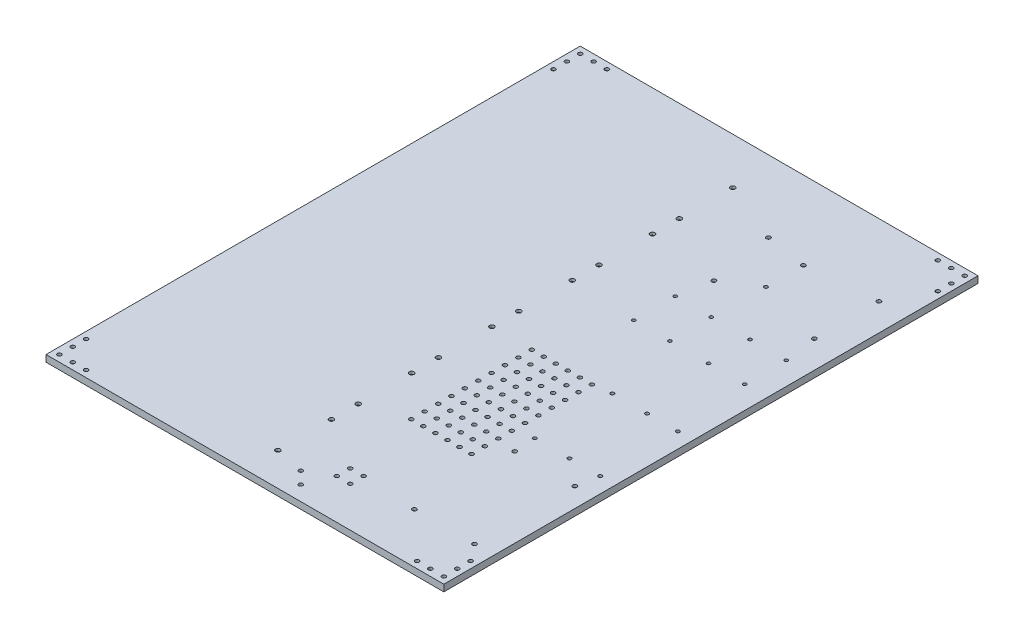
from build123d import *

# Parameters (mm, degrees)
SKETCH1_W           = 297.5
SKETCH1_H           = 399.5
BOSS_EXTRUDE1_DEPTH = 5
SKETCH3_R           = 1.749864578
SKETCH3_R_2         = 1.750391844
SKETCH3_R_3         = 1.750224182
SKETCH3_R_4         = 1.74961836
SKETCH3_R_5         = 1.75096205
SKETCH3_R_6         = 1.748620385
SKETCH3_R_7         = 1.748899818
SKETCH3_R_8         = 1.749915058
SKETCH3_R_9         = 1.748890378
SKETCH3_R_10        = 1.750988741
SKETCH3_R_11        = 1.752219163
CUT_EXTRUDE2_DEPTH  = 10
SKETCH5_R           = 1.5
CUT_EXTRUDE3_DEPTH  = 10
CUT_EXTRUDE4_START  = -3
SKETCH6_R           = 1.5
CUT_EXTRUDE4_DEPTH  = 3
CUT_EXTRUDE5_DEPTH  = 3
SKETCH13_R          = 1.5
CUT_EXTRUDE6_DEPTH  = 5
CUT_EXTRUDE7_DEPTH  = 3
SKETCH15_R          = 1.5
CUT_EXTRUDE8_DEPTH  = 10
CUT_EXTRUDE9_DEPTH  = 3
SKETCH21_R          = 1.5508
SKETCH21_R_2        = 1.5621
SKETCH21_R_3        = 1.315256363
CUT_EXTRUDE10_DEPTH = 10
SKETCH22_R          = 1.5
CUT_EXTRUDE11_DEPTH = 10
SKETCH23_R          = 4.5
CUT_EXTRUDE12_DEPTH = 3
CUT_EXTRUDE13_DEPTH = 5
CUT_EXTRUDE14_DEPTH = 3


with BuildPart() as part:
    # Sketch1 → Boss-Extrude1 (new body)
    with BuildSketch(Plane(origin=(0, 0, 0), x_dir=(1, 0, 0), z_dir=(0, 1, 0))):
        with Locations((148.75, 199.75)):
            Rectangle(SKETCH1_W, SKETCH1_H)
    extrude(amount=BOSS_EXTRUDE1_DEPTH)

    # Sketch3 → Cut-Extrude2 (cut)
    with BuildSketch(Plane(origin=(0, 5, 0), x_dir=(1, 0, 0), z_dir=(0, 1, 0))):
        with Locations((148.748083814, 24.684748422)):
            Circle(SKETCH3_R)
        with Locations((148.748340036, 64.683726641)):
            Circle(SKETCH3_R_2)
        with Locations((148.75044634, 84.720729049)):
            Circle(SKETCH3_R_3)
        with Locations((148.748021994, 124.721020588)):
            Circle(SKETCH3_R_4)
        with Locations((148.749007517, 144.750094856)):
            Circle(SKETCH3_R_5)
        with Locations((148.747543438, 184.752595185)):
            Circle(SKETCH3_R_6)
        with Locations((148.747015223, 204.786810925)):
            Circle(SKETCH3_R_7)
        with Locations((148.748242067, 244.786829837)):
            Circle(SKETCH3_R_8)
        with Locations((148.746998642, 264.816839038)):
            Circle(SKETCH3_R_9)
        with Locations((148.750231988, 304.815858705)):
            Circle(SKETCH3_R_10)
        with Locations((148.747015223, 324.852824112)):
            Circle(SKETCH3_R_7)
        with Locations((148.751036789, 364.852854296)):
            Circle(SKETCH3_R_11)
    extrude(amount=-CUT_EXTRUDE2_DEPTH, mode=Mode.SUBTRACT)

    # Sketch5 → Cut-Extrude3 (cut)
    with BuildSketch(Plane(origin=(0, 5, 0), x_dir=(1, 0, 0), z_dir=(0, 1, 0))):
        with Locations((5, 5)):
            Circle(SKETCH5_R)
        with Locations((5, 15)):
            Circle(SKETCH5_R)
        with Locations((15, 5)):
            Circle(SKETCH5_R)
        with Locations((5, 25)):
            Circle(SKETCH5_R)
        with Locations((25, 5)):
            Circle(SKETCH5_R)
        with Locations((25, 394.5)):
            Circle(SKETCH5_R)
        with Locations((15, 394.5)):
            Circle(SKETCH5_R)
        with Locations((5, 374.5)):
            Circle(SKETCH5_R)
        with Locations((5, 384.5)):
            Circle(SKETCH5_R)
        with Locations((5, 394.5)):
            Circle(SKETCH5_R)
        with Locations((292.5, 374.5)):
            Circle(SKETCH5_R)
        with Locations((292.5, 384.5)):
            Circle(SKETCH5_R)
        with Locations((292.5, 394.5)):
            Circle(SKETCH5_R)
        with Locations((282.5, 394.5)):
            Circle(SKETCH5_R)
        with Locations((272.5, 394.5)):
            Circle(SKETCH5_R)
        with Locations((292.5, 25)):
            Circle(SKETCH5_R)
        with Locations((292.5, 15)):
            Circle(SKETCH5_R)
        with Locations((292.5, 5)):
            Circle(SKETCH5_R)
        with Locations((282.5, 5)):
            Circle(SKETCH5_R)
        with Locations((272.5, 5)):
            Circle(SKETCH5_R)
    extrude(amount=-CUT_EXTRUDE3_DEPTH, mode=Mode.SUBTRACT)

    # Sketch6 → Cut-Extrude4 (cut)
    # profile 1 of 20: a face of its own
    with BuildSketch(Plane.XZ.offset(CUT_EXTRUDE4_START)):
        Polygon((3.104551732, -391.216987298), (1.209103465, -394.5), (3.104551732, -397.783012702), (6.895448268, -397.783012702), (8.790896535, -394.5), (6.895448267, -391.216987298), align=None)
        with Locations((5, -394.5)):
            Circle(SKETCH6_R, mode=Mode.SUBTRACT)
    # profile 2 of 20: a face of its own
    with BuildSketch(Plane.XZ.offset(CUT_EXTRUDE4_START)):
        Polygon((3.104551732, -381.216987298), (1.209103465, -384.5), (3.104551732, -387.783012702), (6.895448267, -387.783012702), (8.790896535, -384.5), (6.895448267, -381.216987298), align=None)
        with Locations((5, -384.5)):
            Circle(SKETCH6_R, mode=Mode.SUBTRACT)
    # profile 3 of 20: a face of its own
    with BuildSketch(Plane.XZ.offset(CUT_EXTRUDE4_START)):
        Polygon((3.104551732, -371.216987298), (1.209103465, -374.5), (3.104551733, -377.783012702), (6.895448268, -377.783012702), (8.790896535, -374.5), (6.895448268, -371.216987298), align=None)
        with Locations((5, -374.5)):
            Circle(SKETCH6_R, mode=Mode.SUBTRACT)
    # profile 4 of 20: a face of its own
    with BuildSketch(Plane.XZ.offset(CUT_EXTRUDE4_START)):
        Polygon((13.104551732, -391.216987298), (11.209103465, -394.5), (13.104551732, -397.783012702), (16.895448267, -397.783012702), (18.790896535, -394.5), (16.895448267, -391.216987298), align=None)
        with Locations((15, -394.5)):
            Circle(SKETCH6_R, mode=Mode.SUBTRACT)
    # profile 5 of 20: a face of its own
    with BuildSketch(Plane.XZ.offset(CUT_EXTRUDE4_START)):
        Polygon((23.104551732, -391.216987298), (21.209103465, -394.5), (23.104551732, -397.783012702), (26.895448267, -397.783012702), (28.790896535, -394.5), (26.895448268, -391.216987298), align=None)
        with Locations((25, -394.5)):
            Circle(SKETCH6_R, mode=Mode.SUBTRACT)
    # profile 6 of 20: a face of its own
    with BuildSketch(Plane.XZ.offset(CUT_EXTRUDE4_START)):
        Polygon((1.209103465, -25), (3.104551732, -28.283012702), (6.895448268, -28.283012702), (8.790896535, -25), (6.895448268, -21.716987298), (3.104551733, -21.716987298), align=None)
        with Locations((5, -25)):
            Circle(SKETCH6_R, mode=Mode.SUBTRACT)
    # profile 7 of 20: a face of its own
    with BuildSketch(Plane.XZ.offset(CUT_EXTRUDE4_START)):
        Polygon((1.209103465, -15), (3.104551732, -18.283012702), (6.895448267, -18.283012702), (8.790896535, -15), (6.895448267, -11.716987298), (3.104551732, -11.716987298), align=None)
        with Locations((5, -15)):
            Circle(SKETCH6_R, mode=Mode.SUBTRACT)
    # profile 8 of 20: a face of its own
    with BuildSketch(Plane.XZ.offset(CUT_EXTRUDE4_START)):
        Polygon((1.209103465, -5), (3.104551732, -8.283012702), (6.895448267, -8.283012702), (8.790896535, -5), (6.895448268, -1.716987298), (3.104551732, -1.716987298), align=None)
        with Locations((5, -5)):
            Circle(SKETCH6_R, mode=Mode.SUBTRACT)
    # profile 9 of 20: a face of its own
    with BuildSketch(Plane.XZ.offset(CUT_EXTRUDE4_START)):
        Polygon((11.209103465, -5), (13.104551732, -8.283012702), (16.895448267, -8.283012702), (18.790896535, -5), (16.895448267, -1.716987298), (13.104551732, -1.716987298), align=None)
        with Locations((15, -5)):
            Circle(SKETCH6_R, mode=Mode.SUBTRACT)
    # profile 10 of 20: a face of its own
    with BuildSketch(Plane.XZ.offset(CUT_EXTRUDE4_START)):
        Polygon((21.209103465, -5), (23.104551732, -8.283012702), (26.895448268, -8.283012702), (28.790896535, -5), (26.895448267, -1.716987298), (23.104551732, -1.716987298), align=None)
        with Locations((25, -5)):
            Circle(SKETCH6_R, mode=Mode.SUBTRACT)
    # profile 11 of 20: a face of its own
    with BuildSketch(Plane.XZ.offset(CUT_EXTRUDE4_START)):
        Polygon((268.709103465, -5), (270.604551732, -8.283012702), (274.395448267, -8.283012702), (276.290896535, -5), (274.395448267, -1.716987298), (270.604551732, -1.716987298), align=None)
        with Locations((272.5, -5)):
            Circle(SKETCH6_R, mode=Mode.SUBTRACT)
    # profile 12 of 20: a face of its own
    with BuildSketch(Plane.XZ.offset(CUT_EXTRUDE4_START)):
        Polygon((278.709103465, -5), (280.604551732, -8.283012702), (284.395448267, -8.283012702), (286.290896535, -5), (284.395448267, -1.716987298), (280.604551732, -1.716987298), align=None)
        with Locations((282.5, -5)):
            Circle(SKETCH6_R, mode=Mode.SUBTRACT)
    # profile 13 of 20: a face of its own
    with BuildSketch(Plane.XZ.offset(CUT_EXTRUDE4_START)):
        Polygon((288.709103465, -5), (290.604551732, -8.283012702), (294.395448267, -8.283012702), (296.290896535, -5), (294.395448267, -1.716987298), (290.604551732, -1.716987298), align=None)
        with Locations((292.5, -5)):
            Circle(SKETCH6_R, mode=Mode.SUBTRACT)
    # profile 14 of 20: a face of its own
    with BuildSketch(Plane.XZ.offset(CUT_EXTRUDE4_START)):
        Polygon((288.709103465, -15), (290.604551732, -18.283012702), (294.395448267, -18.283012702), (296.290896535, -15), (294.395448267, -11.716987298), (290.604551732, -11.716987298), align=None)
        with Locations((292.5, -15)):
            Circle(SKETCH6_R, mode=Mode.SUBTRACT)
    # profile 15 of 20: a face of its own
    with BuildSketch(Plane.XZ.offset(CUT_EXTRUDE4_START)):
        Polygon((288.709103465, -25), (290.604551732, -28.283012702), (294.395448267, -28.283012702), (296.290896535, -25), (294.395448267, -21.716987298), (290.604551732, -21.716987298), align=None)
        with Locations((292.5, -25)):
            Circle(SKETCH6_R, mode=Mode.SUBTRACT)
    # profile 16 of 20: a face of its own
    with BuildSketch(Plane.XZ.offset(CUT_EXTRUDE4_START)):
        Polygon((296.290896535, -374.5), (294.395448267, -371.216987298), (290.604551732, -371.216987298), (288.709103465, -374.5), (290.604551732, -377.783012702), (294.395448267, -377.783012702), align=None)
        with Locations((292.5, -374.5)):
            Circle(SKETCH6_R, mode=Mode.SUBTRACT)
    # profile 17 of 20: a face of its own
    with BuildSketch(Plane.XZ.offset(CUT_EXTRUDE4_START)):
        Polygon((296.290896535, -384.5), (294.395448267, -381.216987298), (290.604551732, -381.216987298), (288.709103465, -384.5), (290.604551732, -387.783012702), (294.395448267, -387.783012702), align=None)
        with Locations((292.5, -384.5)):
            Circle(SKETCH6_R, mode=Mode.SUBTRACT)
    # profile 18 of 20: a face of its own
    with BuildSketch(Plane.XZ.offset(CUT_EXTRUDE4_START)):
        Polygon((296.290896535, -394.5), (294.395448267, -391.216987298), (290.604551732, -391.216987298), (288.709103465, -394.5), (290.604551732, -397.783012702), (294.395448267, -397.783012702), align=None)
        with Locations((292.5, -394.5)):
            Circle(SKETCH6_R, mode=Mode.SUBTRACT)
    # profile 19 of 20: a face of its own
    with BuildSketch(Plane.XZ.offset(CUT_EXTRUDE4_START)):
        Polygon((286.290896535, -394.5), (284.395448267, -391.216987298), (280.604551732, -391.216987298), (278.709103465, -394.5), (280.604551732, -397.783012702), (284.395448267, -397.783012702), align=None)
        with Locations((282.5, -394.5)):
            Circle(SKETCH6_R, mode=Mode.SUBTRACT)
    # profile 20 of 20: a face of its own
    with BuildSketch(Plane.XZ.offset(CUT_EXTRUDE4_START)):
        Polygon((276.290896535, -394.5), (274.395448267, -391.216987298), (270.604551732, -391.216987298), (268.709103465, -394.5), (270.604551732, -397.783012702), (274.395448267, -397.783012702), align=None)
        with Locations((272.5, -394.5)):
            Circle(SKETCH6_R, mode=Mode.SUBTRACT)
    extrude(amount=CUT_EXTRUDE4_DEPTH, mode=Mode.SUBTRACT)

    # Sketch7 → Cut-Extrude5 (cut)
    with BuildSketch(Plane.XZ):
        Polygon((152.541933324, -364.852854296), (150.646485057, -361.569841594), (146.855588522, -361.569841594), (144.960140254, -364.852854296), (146.855588522, -368.135866999), (150.646485057, -368.135866999), align=None)
        Polygon((152.537911758, -324.852824112), (150.642463491, -321.56981141), (146.851566956, -321.56981141), (144.956118688, -324.852824112), (146.851566956, -328.135836814), (150.642463491, -328.135836814), align=None)
        Polygon((152.541128523, -304.815858705), (150.645680256, -301.532846002), (146.854783721, -301.532846002), (144.959335453, -304.815858705), (146.854783721, -308.098871407), (150.645680256, -308.098871407), align=None)
        Polygon((152.537895177, -264.816839038), (150.64244691, -261.533826336), (146.851550375, -261.533826336), (144.956102107, -264.816839038), (146.851550375, -268.099851741), (150.64244691, -268.099851741), align=None)
        Polygon((152.539138602, -244.786829837), (150.643690334, -241.503817134), (146.852793799, -241.503817134), (144.957345532, -244.786829837), (146.852793799, -248.069842539), (150.643690334, -248.069842539), align=None)
        Polygon((152.538980349, -24.684748422), (150.643532082, -21.40173572), (146.852635547, -21.40173572), (144.957187279, -24.684748422), (146.852635547, -27.967761125), (150.643532082, -27.967761125), align=None)
        Polygon((152.539236571, -64.683726641), (150.643788303, -61.400713939), (146.852891768, -61.400713939), (144.957443501, -64.683726641), (146.852891768, -67.966739344), (150.643788303, -67.966739344), align=None)
        Polygon((152.541342875, -84.720729049), (150.645894608, -81.437716346), (146.854998073, -81.437716346), (144.959549805, -84.720729049), (146.854998073, -88.003741751), (150.645894608, -88.003741751), align=None)
        Polygon((152.538918529, -124.721020588), (150.643470261, -121.438007886), (146.852573726, -121.438007886), (144.957125459, -124.721020588), (146.852573726, -128.004033291), (150.643470261, -128.004033291), align=None)
        Polygon((152.539904052, -144.750094856), (150.644455784, -141.467082153), (146.853559249, -141.467082153), (144.958110982, -144.750094856), (146.853559249, -148.033107558), (150.644455784, -148.033107558), align=None)
        Polygon((152.538439973, -184.752595185), (150.642991706, -181.469582482), (146.852095171, -181.469582482), (144.956646903, -184.752595185), (146.852095171, -188.035607887), (150.642991706, -188.035607887), align=None)
        Polygon((152.537911758, -204.786810925), (150.642463491, -201.503798222), (146.851566956, -201.503798222), (144.956118688, -204.786810925), (146.851566956, -208.069823627), (150.642463491, -208.069823627), align=None)
    extrude(amount=-CUT_EXTRUDE5_DEPTH, mode=Mode.SUBTRACT)

    # Sketch13 → Cut-Extrude6 (cut)
    with BuildSketch(Plane(origin=(0, 5, 0), x_dir=(1, 0, 0), z_dir=(0, 1, 0))):
        with Locations((170.5, 20)):
            Circle(SKETCH13_R)
        with Locations((179.5, 11)):
            Circle(SKETCH13_R)
    extrude(amount=-CUT_EXTRUDE6_DEPTH, mode=Mode.SUBTRACT)

    # Sketch14 → Cut-Extrude7 (cut)
    with BuildSketch(Plane.XZ):
        Polygon((181.524855436, -14.20481778), (183.28788133, -10.848832643), (181.263025894, -7.644014863), (177.475144564, -7.79518222), (175.71211867, -11.151167357), (177.736974106, -14.355985137), align=None)
        Polygon((172.524855436, -23.20481778), (174.28788133, -19.848832643), (172.263025894, -16.644014863), (168.475144564, -16.79518222), (166.71211867, -20.151167357), (168.736974106, -23.355985137), align=None)
    extrude(amount=-CUT_EXTRUDE7_DEPTH, mode=Mode.SUBTRACT)

    # Sketch15 → Cut-Extrude8 (cut)
    with BuildSketch(Plane(origin=(0, 5, 0), x_dir=(1, 0, 0), z_dir=(0, 1, 0))):
        with Locations((187.5, 30)):
            Circle(SKETCH15_R)
        with Locations((197.5, 30)):
            Circle(SKETCH15_R)
        with Locations((187.5, 40)):
            Circle(SKETCH15_R)
        with Locations((197.5, 40)):
            Circle(SKETCH15_R)
    extrude(amount=-CUT_EXTRUDE8_DEPTH, mode=Mode.SUBTRACT)

    # Sketch16 → Cut-Extrude9 (cut)
    with BuildSketch(Plane.XZ):
        Polygon((191.29, -30), (189.395, -26.71776372), (185.605, -26.71776372), (183.71, -30), (185.605, -33.28223628), (189.395, -33.28223628), align=None)
        Polygon((201.29, -30), (199.395, -26.71776372), (195.605, -26.71776372), (193.71, -30), (195.605, -33.28223628), (199.395, -33.28223628), align=None)
        Polygon((201.29, -40), (199.395, -36.71776372), (195.605, -36.71776372), (193.71, -40), (195.605, -43.28223628), (199.395, -43.28223628), align=None)
        Polygon((191.29, -40), (189.395, -36.71776372), (185.605, -36.71776372), (183.71, -40), (185.605, -43.28223628), (189.395, -43.28223628), align=None)
    extrude(amount=-CUT_EXTRUDE9_DEPTH, mode=Mode.SUBTRACT)

    # Sketch21 → Cut-Extrude10 (cut)
    with BuildSketch(Plane(origin=(0, 5, 0), x_dir=(1, 0, 0), z_dir=(0, 1, 0))):
        with Locations((238, 112.5)):
            Circle(SKETCH21_R)
        with Locations((238, 37.5)):
            Circle(SKETCH21_R)
        with Locations((283, 37.5)):
            Circle(SKETCH21_R)
        with Locations((283, 112.5)):
            Circle(SKETCH21_R)
        with Locations((201.8944, 297.54)):
            Circle(SKETCH21_R_2)
        with Locations((194.4014, 345.8762)):
            Circle(SKETCH21_R_2)
        with Locations((225.4021, 312.981507234)):
            Circle(SKETCH21_R_3)
        with Locations((225.4021, 340.997707234)):
            Circle(SKETCH21_R_2)
        with Locations((277.0276, 345.8762)):
            Circle(SKETCH21_R_2)
        with Locations((277.0276, 297.54)):
            Circle(SKETCH21_R_2)
        with BuildLine():
            ThreePointArc((196.25, 273), (197.5, 271.75), (198.75, 273))
            ThreePointArc((198.75, 273), (197.5, 274.25), (196.25, 273))
        make_face()
        with BuildLine():
            ThreePointArc((223.25, 273), (224.5, 271.75), (225.75, 273))
            ThreePointArc((225.75, 273), (224.5, 274.25), (223.25, 273))
        make_face()
        with BuildLine():
            ThreePointArc((225.75, 242), (224.5, 243.25), (223.25, 242))
            ThreePointArc((223.25, 242), (224.5, 240.75), (225.75, 242))
        make_face()
        with BuildLine():
            ThreePointArc((196.25, 242), (197.5, 240.75), (198.75, 242))
            ThreePointArc((198.75, 242), (197.5, 243.25), (196.25, 242))
        make_face()
        with BuildLine():
            ThreePointArc((254.75, 273), (253.5, 274.25), (252.25, 273))
            ThreePointArc((252.25, 273), (253.5, 271.75), (254.75, 273))
        make_face()
        with BuildLine():
            ThreePointArc((279.25, 273), (280.5, 271.75), (281.75, 273))
            ThreePointArc((281.75, 273), (280.5, 274.25), (279.25, 273))
        make_face()
        with BuildLine():
            ThreePointArc((281.75, 242), (280.5, 243.25), (279.25, 242))
            ThreePointArc((279.25, 242), (280.5, 240.75), (281.75, 242))
        make_face()
        with BuildLine():
            ThreePointArc((252.25, 242), (253.5, 240.75), (254.75, 242))
            ThreePointArc((254.75, 242), (253.5, 243.25), (252.25, 242))
        make_face()
        with BuildLine():
            ThreePointArc((287.35, 128.5), (286, 129.85), (284.65, 128.5))
            ThreePointArc((284.65, 128.5), (286, 127.15), (287.35, 128.5))
        make_face()
        with BuildLine():
            ThreePointArc((284.65, 186.5), (286, 185.15), (287.35, 186.5))
            ThreePointArc((287.35, 186.5), (286, 187.85), (284.65, 186.5))
        make_face()
        with BuildLine():
            ThreePointArc((261.65, 186.5), (263, 185.15), (264.35, 186.5))
            ThreePointArc((264.35, 186.5), (263, 187.85), (261.65, 186.5))
        make_face()
        with BuildLine():
            ThreePointArc((261.65, 128.5), (263, 127.15), (264.35, 128.5))
            ThreePointArc((264.35, 128.5), (263, 129.85), (261.65, 128.5))
        make_face()
        with BuildLine():
            ThreePointArc((235.65, 128.5), (237, 127.15), (238.35, 128.5))
            ThreePointArc((238.35, 128.5), (237, 129.85), (235.65, 128.5))
        make_face()
    extrude(amount=-CUT_EXTRUDE10_DEPTH, mode=Mode.SUBTRACT)

    # Sketch22 → Cut-Extrude11 (cut)
    with BuildSketch(Plane(origin=(0, 5, 0), x_dir=(1, 0, 0), z_dir=(0, 1, 0))):
        with Locations((178.525213153, 184.701804865)):
            Circle(SKETCH22_R)
        with Locations((178.525213153, 174.701804865)):
            Circle(SKETCH22_R)
        with Locations((178.525213153, 164.701804865)):
            Circle(SKETCH22_R)
        with Locations((178.525213153, 154.701804865)):
            Circle(SKETCH22_R)
        with Locations((178.525213153, 144.701804865)):
            Circle(SKETCH22_R)
        with Locations((178.525213153, 134.701804865)):
            Circle(SKETCH22_R)
        with Locations((178.525213153, 124.701804865)):
            Circle(SKETCH22_R)
        with Locations((178.525213153, 114.701804865)):
            Circle(SKETCH22_R)
        with Locations((178.525213153, 104.701804865)):
            Circle(SKETCH22_R)
        with Locations((178.525213153, 94.701804865)):
            Circle(SKETCH22_R)
        with Locations((187.525213153, 174.701804865)):
            Circle(SKETCH22_R)
        with Locations((187.525213153, 164.701804865)):
            Circle(SKETCH22_R)
        with Locations((187.525213153, 154.701804865)):
            Circle(SKETCH22_R)
        with Locations((187.525213153, 144.701804865)):
            Circle(SKETCH22_R)
        with Locations((187.525213153, 134.701804865)):
            Circle(SKETCH22_R)
        with Locations((187.525213153, 124.701804865)):
            Circle(SKETCH22_R)
        with Locations((187.525213153, 114.701804865)):
            Circle(SKETCH22_R)
        with Locations((187.525213153, 104.701804865)):
            Circle(SKETCH22_R)
        with Locations((187.525213153, 94.701804865)):
            Circle(SKETCH22_R)
        with Locations((196.525213153, 174.701804865)):
            Circle(SKETCH22_R)
        with Locations((196.525213153, 164.701804865)):
            Circle(SKETCH22_R)
        with Locations((196.525213153, 154.701804865)):
            Circle(SKETCH22_R)
        with Locations((196.525213153, 144.701804865)):
            Circle(SKETCH22_R)
        with Locations((196.525213153, 134.701804865)):
            Circle(SKETCH22_R)
        with Locations((196.525213153, 124.701804865)):
            Circle(SKETCH22_R)
        with Locations((196.525213153, 114.701804865)):
            Circle(SKETCH22_R)
        with Locations((196.525213153, 104.701804865)):
            Circle(SKETCH22_R)
        with Locations((196.525213153, 94.701804865)):
            Circle(SKETCH22_R)
        with Locations((205.525213153, 174.701804865)):
            Circle(SKETCH22_R)
        with Locations((205.525213153, 164.701804865)):
            Circle(SKETCH22_R)
        with Locations((205.525213153, 154.701804865)):
            Circle(SKETCH22_R)
        with Locations((205.525213153, 144.701804865)):
            Circle(SKETCH22_R)
        with Locations((205.525213153, 134.701804865)):
            Circle(SKETCH22_R)
        with Locations((205.525213153, 124.701804865)):
            Circle(SKETCH22_R)
        with Locations((205.525213153, 114.701804865)):
            Circle(SKETCH22_R)
        with Locations((205.525213153, 104.701804865)):
            Circle(SKETCH22_R)
        with Locations((205.525213153, 94.701804865)):
            Circle(SKETCH22_R)
        with Locations((214.525213153, 174.701804865)):
            Circle(SKETCH22_R)
        with Locations((214.525213153, 164.701804865)):
            Circle(SKETCH22_R)
        with Locations((214.525213153, 154.701804865)):
            Circle(SKETCH22_R)
        with Locations((214.525213153, 144.701804865)):
            Circle(SKETCH22_R)
        with Locations((214.525213153, 134.701804865)):
            Circle(SKETCH22_R)
        with Locations((214.525213153, 124.701804865)):
            Circle(SKETCH22_R)
        with Locations((214.525213153, 114.701804865)):
            Circle(SKETCH22_R)
        with Locations((214.525213153, 104.701804865)):
            Circle(SKETCH22_R)
        with Locations((214.525213153, 94.701804865)):
            Circle(SKETCH22_R)
        with Locations((223.525213153, 174.701804865)):
            Circle(SKETCH22_R)
        with Locations((223.525213153, 164.701804865)):
            Circle(SKETCH22_R)
        with Locations((223.525213153, 154.701804865)):
            Circle(SKETCH22_R)
        with Locations((223.525213153, 144.701804865)):
            Circle(SKETCH22_R)
        with Locations((223.525213153, 134.701804865)):
            Circle(SKETCH22_R)
        with Locations((223.525213153, 124.701804865)):
            Circle(SKETCH22_R)
        with Locations((223.525213153, 114.701804865)):
            Circle(SKETCH22_R)
        with Locations((223.525213153, 104.701804865)):
            Circle(SKETCH22_R)
        with Locations((223.525213153, 94.701804865)):
            Circle(SKETCH22_R)
        with Locations((187.525213153, 184.701804865)):
            Circle(SKETCH22_R)
        with Locations((196.525213153, 184.701804865)):
            Circle(SKETCH22_R)
        with Locations((205.525213153, 184.701804865)):
            Circle(SKETCH22_R)
        with Locations((214.525213153, 184.701804865)):
            Circle(SKETCH22_R)
        with Locations((223.525213153, 184.701804865)):
            Circle(SKETCH22_R)
    extrude(amount=-CUT_EXTRUDE11_DEPTH, mode=Mode.SUBTRACT)

    # Sketch23 → Cut-Extrude12 (cut)
    with BuildSketch(Plane.XZ):
        with Locations((283, -37.5)):
            Circle(SKETCH23_R)
        with Locations((238, -37.5)):
            Circle(SKETCH23_R)
        with Locations((238, -112.5)):
            Circle(SKETCH23_R)
        with Locations((283, -112.5)):
            Circle(SKETCH23_R)
    extrude(amount=-CUT_EXTRUDE12_DEPTH, mode=Mode.SUBTRACT)

    # Sketch24 → Cut-Extrude13 (cut)
    with BuildSketch(Plane(origin=(0, 5, 0), x_dir=(1, 0, 0), z_dir=(0, 1, 0))):
        with BuildLine():
            ThreePointArc((238.35, 186.5), (237, 187.85), (235.65, 186.5))
            ThreePointArc((235.65, 186.5), (237, 185.15), (238.35, 186.5))
        make_face()
    extrude(amount=-CUT_EXTRUDE13_DEPTH, mode=Mode.SUBTRACT)

    # Sketch28 → Cut-Extrude14 (cut)
    with BuildSketch(Plane.XZ):
        Polygon((289.79, -128.5), (287.895, -125.21776372), (284.105, -125.21776372), (282.21, -128.5), (284.105, -131.78223628), (287.895, -131.78223628), align=None)
        Polygon((266.79, -128.5), (264.895, -125.21776372), (261.105, -125.21776372), (259.21, -128.5), (261.105, -131.78223628), (264.895, -131.78223628), align=None)
        Polygon((240.79, -128.5), (238.895, -125.21776372), (235.105, -125.21776372), (233.21, -128.5), (235.105, -131.78223628), (238.895, -131.78223628), align=None)
        Polygon((289.79, -186.5), (287.895, -183.21776372), (284.105, -183.21776372), (282.21, -186.5), (284.105, -189.78223628), (287.895, -189.78223628), align=None)
        Polygon((266.79, -186.5), (264.895, -183.21776372), (261.105, -183.21776372), (259.21, -186.5), (261.105, -189.78223628), (264.895, -189.78223628), align=None)
        Polygon((240.79, -186.5), (238.895, -183.21776372), (235.105, -183.21776372), (233.21, -186.5), (235.105, -189.78223628), (238.895, -189.78223628), align=None)
        Polygon((284.29, -242), (282.395, -238.71776372), (278.605, -238.71776372), (276.71, -242), (278.605, -245.28223628), (282.395, -245.28223628), align=None)
        Polygon((257.29, -242), (255.395, -238.71776372), (251.605, -238.71776372), (249.71, -242), (251.605, -245.28223628), (255.395, -245.28223628), align=None)
        Polygon((228.29, -242), (226.395, -238.71776372), (222.605, -238.71776372), (220.71, -242), (222.605, -245.28223628), (226.395, -245.28223628), align=None)
        Polygon((201.29, -242), (199.395, -238.71776372), (195.605, -238.71776372), (193.71, -242), (195.605, -245.28223628), (199.395, -245.28223628), align=None)
        Polygon((201.29, -273), (199.395, -269.71776372), (195.605, -269.71776372), (193.71, -273), (195.605, -276.28223628), (199.395, -276.28223628), align=None)
        Polygon((205.6844, -297.54), (203.7894, -294.25776372), (199.9994, -294.25776372), (198.1044, -297.54), (199.9994, -300.82223628), (203.7894, -300.82223628), align=None)
        Polygon((198.1914, -345.8762), (196.2964, -342.59396372), (192.5064, -342.59396372), (190.6114, -345.8762), (192.5064, -349.15843628), (196.2964, -349.15843628), align=None)
        Polygon((229.1921, -312.981507234), (227.2971, -309.699270953), (223.5071, -309.699270953), (221.6121, -312.981507234), (223.5071, -316.263743514), (227.2971, -316.263743514), align=None)
        Polygon((229.1921, -340.997707234), (227.2971, -337.715470953), (223.5071, -337.715470953), (221.6121, -340.997707234), (223.5071, -344.279943514), (227.2971, -344.279943514), align=None)
        Polygon((228.29, -273), (226.395, -269.71776372), (222.605, -269.71776372), (220.71, -273), (222.605, -276.28223628), (226.395, -276.28223628), align=None)
        Polygon((257.29, -273), (255.395, -269.71776372), (251.605, -269.71776372), (249.71, -273), (251.605, -276.28223628), (255.395, -276.28223628), align=None)
        Polygon((284.29, -273), (282.395, -269.71776372), (278.605, -269.71776372), (276.71, -273), (278.605, -276.28223628), (282.395, -276.28223628), align=None)
        Polygon((280.8176, -297.54), (278.9226, -294.25776372), (275.1326, -294.25776372), (273.2376, -297.54), (275.1326, -300.82223628), (278.9226, -300.82223628), align=None)
        Polygon((280.8176, -345.8762), (278.9226, -342.59396372), (275.1326, -342.59396372), (273.2376, -345.8762), (275.1326, -349.15843628), (278.9226, -349.15843628), align=None)
    extrude(amount=-CUT_EXTRUDE14_DEPTH, mode=Mode.SUBTRACT)


solid = part.part
